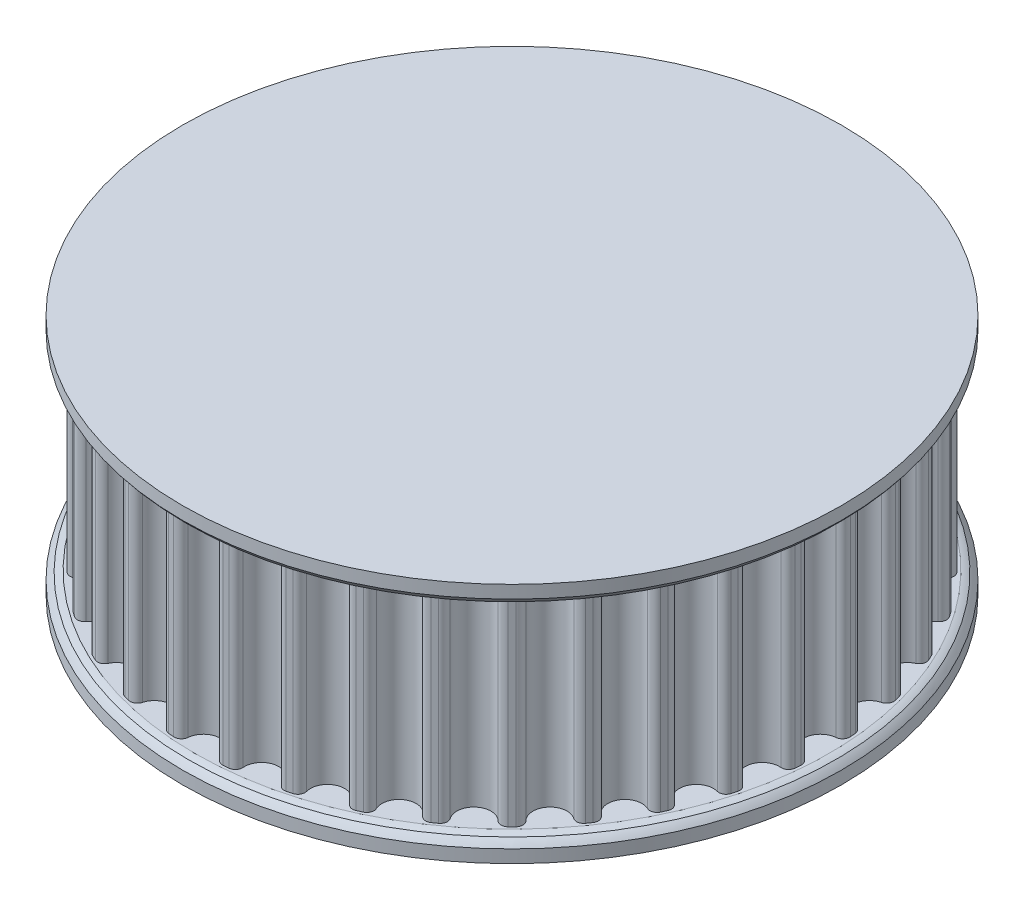
from build123d import *

# Parameters (mm, degrees)
SKETCH1_R               = 28.076389218
TOOTHOD_DEPTH           = 8.89
TOOTHPROFILE_DEPTH      = 44.505122262
TOOTHPATTERN_COUNT      = 36
LARGE_TOOTH_COUNT_DEPTH = 0.4


with BuildPart() as part:
    # Sketch1 → ToothOD (new, symmetric)
    with BuildSketch(Plane(origin=(0, 0, 0), x_dir=(1, 0, 0), z_dir=(0, 1, 0))):
        Circle(SKETCH1_R)
    extrude(amount=TOOTHOD_DEPTH, both=True)

    # Sketch2 → ToothProfile (cut, through all)
    with BuildSketch(Plane(origin=(0, 8.89, 0), x_dir=(1, 0, 0), z_dir=(0, 1, 0))):
        with BuildLine():
            ThreePointArc((-1.519425396, 27.411114635), (0, 26.016389218), (1.519425396, 27.411114635))
            ThreePointArc((1.519425396, 27.411114635), (1.741386688, 27.84115848), (2.201904348, 27.98991334))
            ThreePointArc((2.201904348, 27.98991334), (0, 28.076389218), (-2.201904348, 27.98991334))
            ThreePointArc((-2.201904348, 27.98991334), (-1.741386688, 27.84115848), (-1.519425396, 27.411114635))
        make_face()
    toothprofile = extrude(amount=-TOOTHPROFILE_DEPTH, mode=Mode.SUBTRACT)

    # ToothPattern: ToothProfile ×36 about axis
    toothpattern_axis = Axis((0, 8.89, 0), (0, -1, 0))
    for i in range(1, TOOTHPATTERN_COUNT):
        add(toothprofile.rotate(toothpattern_axis, i * 360 / TOOTHPATTERN_COUNT), mode=Mode.SUBTRACT)

    # Sketch4 → Flange (revolve)
    with BuildSketch(Plane.XY):
        with BuildLine():
            Line((0, -8.89), (28.330389218, -8.89))
            ThreePointArc((28.330389218, -8.89), (28.622194325, -8.974570012), (28.901889218, -9.0932))
            ThreePointArc((28.901889218, -9.0932), (29.172412574, -9.357578767), (29.409889218, -9.652))
            Line((29.409889218, -9.652), (29.409889218, -10.795))
            Line((29.409889218, -10.795), (0, -10.795))
            Line((0, -10.795), (0, -8.89))
        make_face()
        with BuildLine():
            Line((29.409889218, 10.795), (29.409889218, 9.652))
            ThreePointArc((29.409889218, 9.652), (29.172412574, 9.357578767), (28.901889218, 9.0932))
            ThreePointArc((28.901889218, 9.0932), (28.622194325, 8.974570012), (28.330389218, 8.89))
            Line((28.330389218, 8.89), (0, 8.89))
            Line((0, 8.89), (0, 10.795))
            Line((0, 10.795), (29.409889218, 10.795))
        make_face()
    revolve(axis=Axis((0, 12.09802, 0), (0, -1, 0)))

    # Sketch9 → Large Tooth Count (cut)
    # profile 1 of 2: a face of its own
    with BuildSketch(Plane(origin=(0, -10.795, 0), x_dir=(1, 0, 0), z_dir=(0, 1, 0))):
        with BuildLine():
            add(Edge.make_bspline(
                [(-2.884035079, 25.927679637), (-2.831676012, 25.935237516), (-2.730252931, 25.949877644), (-2.58669487, 25.993768546), (-2.458259474, 26.056460669), (-2.362230068, 26.121449448), (-2.296426388, 26.182481156), (-2.253636382, 26.230682319), (-2.219715568, 26.283045088), (-2.192664524, 26.337867987), (-2.172518049, 26.395647847), (-2.16104916, 26.457006077), (-2.157528887, 26.521543707), (-2.160831448, 26.565273661), (-2.162516329, 26.587583543)],
                knots=[0, 0, 0, 0, 1.740208258, 3.370902021, 4.918261647, 6.432614837, 7.167760741, 7.869410875, 8.549014845, 9.215271657, 9.878566188, 10.557109216, 11.263874728, 12, 12, 12, 12], degree=3))
            add(Edge.make_bspline(
                [(-2.162516329, 26.587583543), (-2.168309962, 26.620819923), (-2.179845778, 26.686997533), (-2.227023614, 26.778371141), (-2.295512282, 26.859205997), (-2.382786865, 26.930315039), (-2.488774153, 26.987091558), (-2.611502829, 27.022461704), (-2.748728814, 27.036528925), (-2.843865988, 27.029647292), (-2.893857735, 27.026031199)],
                knots=[0, 0, 0, 0, 0.850222227, 1.69289423, 2.565277518, 3.518771223, 4.526967617, 5.588199176, 6.732670613, 8, 8, 8, 8], degree=3))
            add(Edge.make_bspline(
                [(-2.893857735, 27.026031199), (-2.92519036, 27.022035905), (-2.984912793, 27.014420561), (-3.06865422, 26.996306196), (-3.142935182, 26.975659708), (-3.206800454, 26.948595372), (-3.26197893, 26.917583508), (-3.311151317, 26.88437953), (-3.354161976, 26.847244774), (-3.390652967, 26.804403565), (-3.424514552, 26.756483269), (-3.457551376, 26.701050286), (-3.489243823, 26.636095401), (-3.531981604, 26.541005654), (-3.580933608, 26.420452311), (-3.61983903, 26.324750239), (-3.638593673, 26.278616356)],
                knots=[0, 0, 0, 0, 1.161651273, 2.214198214, 3.149950597, 3.994119379, 4.758968706, 5.475895687, 6.174433602, 6.842065939, 7.541033011, 8.331790609, 9.213421938, 10.19868972, 12.167550603, 14, 14, 14, 14], degree=3))
            add(Edge.make_bspline(
                [(-3.638593673, 26.278616356), (-3.646170923, 26.267210396), (-3.662416976, 26.242755373), (-3.699286097, 26.211670581), (-3.7458031, 26.181540903), (-3.823295482, 26.143666354), (-3.934323504, 26.104723777), (-4.029067247, 26.090429117), (-4.077934298, 26.083056199)],
                knots=[0, 0, 0, 0, 0.496768473, 1.06509974, 1.738921352, 2.514965206, 4.202484234, 6, 6, 6, 6], degree=3))
            add(Edge.make_bspline(
                [(-4.077934298, 26.083056199), (-4.106241545, 26.081416765), (-4.162271571, 26.078171746), (-4.246315592, 26.091797676), (-4.327983067, 26.118868779), (-4.406188329, 26.159098577), (-4.475177937, 26.213899794), (-4.52928993, 26.282443075), (-4.566421022, 26.363353756), (-4.575822274, 26.42230927), (-4.580675704, 26.452745262)],
                knots=[0, 0, 0, 0, 0.977955687, 1.935719217, 2.921872316, 3.943841516, 4.961292039, 5.943408913, 6.938277607, 8, 8, 8, 8], degree=3))
            add(Edge.make_bspline(
                [(-4.580675704, 26.452745262), (-4.582413519, 26.482561203), (-4.585962389, 26.54344967), (-4.569342161, 26.636656979), (-4.541264903, 26.732785573), (-4.495268699, 26.83040787), (-4.435694867, 26.928823925), (-4.361596837, 27.026775064), (-4.273409128, 27.123230795), (-4.171745717, 27.218679007), (-4.055926967, 27.310754187), (-3.924609587, 27.395819511), (-3.778335496, 27.472933754), (-3.618782111, 27.544500161), (-3.446104378, 27.606800017), (-3.261557175, 27.657429942), (-3.066377183, 27.696921381), (-2.932090435, 27.71388289), (-2.863496798, 27.722546824)],
                knots=[0, 0, 0, 0, 0.615610725, 1.25716618, 1.944558692, 2.682656439, 3.480656993, 4.320183036, 5.21778266, 6.180091238, 7.200929026, 8.273026521, 9.410230507, 10.616978748, 11.88637631, 13.201922651, 14.570742808, 16, 16, 16, 16], degree=3))
            add(Edge.make_bspline(
                [(-2.863496798, 27.722546824), (-2.801040711, 27.728416835), (-2.678395584, 27.739943785), (-2.49640722, 27.743130786), (-2.320678615, 27.735535718), (-2.15153077, 27.715743326), (-1.990004054, 27.685726804), (-1.837228499, 27.645074524), (-1.694123755, 27.592969505), (-1.561461133, 27.530738031), (-1.440349165, 27.460043773), (-1.332779968, 27.381116033), (-1.240133777, 27.294123054), (-1.162128365, 27.20002527), (-1.098231171, 27.100427765), (-1.048737485, 26.996434628), (-1.013707029, 26.887969684), (-1.002712281, 26.813426233), (-0.99719211, 26.775999949)],
                knots=[0, 0, 0, 0, 1.300087848, 2.552984794, 3.769882269, 4.944020676, 6.080453409, 7.173156751, 8.21753888, 9.233384416, 10.207027551, 11.120313229, 11.993375782, 12.834812446, 13.647895471, 14.440080806, 15.216806077, 16, 16, 16, 16], degree=3))
            add(Edge.make_bspline(
                [(-0.99719211, 26.775999949), (-0.993812882, 26.727182758), (-0.987177237, 26.631322533), (-1.004634552, 26.489473977), (-1.045608962, 26.354971958), (-1.109148959, 26.228528938), (-1.192177437, 26.109685322), (-1.288558972, 25.995016467), (-1.401207213, 25.886306204), (-1.484747953, 25.820406139), (-1.527615548, 25.786590574)],
                knots=[0, 0, 0, 0, 0.994362274, 1.952586578, 2.889873616, 3.843700919, 4.820142602, 5.834897802, 6.889012454, 8, 8, 8, 8], degree=3))
            add(Edge.make_bspline(
                [(-1.527615548, 25.786590574), (-1.483921418, 25.775154255), (-1.396555963, 25.752287586), (-1.269869753, 25.704220139), (-1.146916588, 25.64685252), (-1.029202007, 25.580442591), (-0.91938119, 25.507042002), (-0.822553539, 25.425818833), (-0.737188336, 25.341090279), (-0.666868788, 25.249668835), (-0.608603087, 25.153985793), (-0.564054797, 25.053770754), (-0.531610115, 24.949157873), (-0.521739913, 24.877155759), (-0.516774923, 24.840936668)],
                knots=[0, 0, 0, 0, 1.102611994, 2.204648487, 3.304091498, 4.414276908, 5.503259953, 6.525433276, 7.497150733, 8.435207282, 9.335505779, 10.227308477, 11.108286225, 12, 12, 12, 12], degree=3))
            add(Edge.make_bspline(
                [(-0.516774923, 24.840936668), (-0.513849553, 24.796897509), (-0.507970285, 24.708389726), (-0.520025694, 24.573539396), (-0.552314148, 24.438624014), (-0.600551992, 24.303302863), (-0.666708579, 24.169788896), (-0.752831196, 24.040500635), (-0.85703851, 23.915169148), (-0.979030067, 23.795516716), (-1.11696605, 23.683104806), (-1.26892908, 23.579025512), (-1.436159631, 23.486862558), (-1.615160774, 23.402428681), (-1.807803446, 23.330956402), (-2.012846829, 23.273645666), (-2.229292721, 23.227229095), (-2.378436582, 23.208381552), (-2.45451711, 23.198767137)],
                knots=[0, 0, 0, 0, 0.755203296, 1.517771262, 2.308060925, 3.125688854, 3.973902143, 4.853469949, 5.780450698, 6.761094328, 7.775587867, 8.82489599, 9.911398865, 11.042734214, 12.212345687, 13.426033089, 14.686980735, 16, 16, 16, 16], degree=3))
            add(Edge.make_bspline(
                [(-2.45451711, 23.198767137), (-2.529467064, 23.19220388), (-2.675913804, 23.179379756), (-2.891552856, 23.180819652), (-3.096988771, 23.197584337), (-3.290571001, 23.234104882), (-3.471477613, 23.282696223), (-3.638085246, 23.342953843), (-3.790760339, 23.410984722), (-3.927790765, 23.489997099), (-4.049817302, 23.57620339), (-4.159730043, 23.665034841), (-4.254493371, 23.758984264), (-4.33468031, 23.854855546), (-4.399311223, 23.949471449), (-4.449248224, 24.039122477), (-4.484450048, 24.122860354), (-4.494054733, 24.178409811), (-4.498522579, 24.204249949)],
                knots=[0, 0, 0, 0, 1.463172344, 2.858932019, 4.190230326, 5.468155111, 6.686213122, 7.831185274, 8.912022685, 9.934231927, 10.903072954, 11.816660061, 12.680756471, 13.494949328, 14.245119792, 14.906085201, 15.491139763, 16, 16, 16, 16], degree=3))
            add(Edge.make_bspline(
                [(-4.498522579, 24.204249949), (-4.50006884, 24.235888809), (-4.503069308, 24.297282978), (-4.481586241, 24.38699047), (-4.437851922, 24.468089505), (-4.373556805, 24.538498443), (-4.295482452, 24.598890857), (-4.205251386, 24.645697399), (-4.105529563, 24.679384387), (-4.034721197, 24.68937406), (-3.998460079, 24.694489793)],
                knots=[0, 0, 0, 0, 0.968847013, 1.880015804, 2.791871975, 3.76951731, 4.785997872, 5.808092692, 6.877519493, 8, 8, 8, 8], degree=3))
            add(Edge.make_bspline(
                [(-3.998460079, 24.694489793), (-3.974965677, 24.696124286), (-3.928273504, 24.699372635), (-3.857918034, 24.696358071), (-3.788663499, 24.681941274), (-3.72190746, 24.66187228), (-3.660623004, 24.638326265), (-3.610751576, 24.610414406), (-3.570604586, 24.582724638), (-3.553553566, 24.558955879), (-3.545724923, 24.548042918)],
                knots=[0, 0, 0, 0, 1.144246022, 2.274045192, 3.408834094, 4.571313731, 5.661908395, 6.587819549, 7.351624938, 8, 8, 8, 8], degree=3))
            add(Edge.make_bspline(
                [(-3.545724923, 24.548042918), (-3.525717534, 24.516338517), (-3.486981127, 24.454955469), (-3.426827037, 24.368177999), (-3.367952935, 24.288591619), (-3.31025799, 24.216158581), (-3.252867741, 24.151625391), (-3.196625893, 24.09431093), (-3.141549456, 24.044015431), (-3.086098207, 24.00117264), (-3.029132295, 23.964469613), (-2.968142217, 23.935197082), (-2.903526836, 23.911812853), (-2.834924299, 23.894962119), (-2.76234196, 23.883546738), (-2.685631209, 23.876913976), (-2.604988049, 23.878339412), (-2.550338462, 23.883050283), (-2.522382735, 23.885460106)],
                knots=[0, 0, 0, 0, 1.377426613, 2.666842544, 3.878731997, 5.014650271, 6.068286915, 7.050530189, 7.964316377, 8.806572593, 9.622789314, 10.449491317, 11.286761617, 12.143592161, 13.04086477, 13.984597961, 14.96903103, 16, 16, 16, 16], degree=3))
            add(Edge.make_bspline(
                [(-2.522382735, 23.885460106), (-2.48591882, 23.89031782), (-2.413424095, 23.89997555), (-2.30770656, 23.928554587), (-2.205442659, 23.966081533), (-2.107348104, 24.013133647), (-2.015616452, 24.069767182), (-1.932744994, 24.135984709), (-1.860983699, 24.211631507), (-1.799880333, 24.294578074), (-1.751840056, 24.384472288), (-1.721723321, 24.480407445), (-1.705817097, 24.580367169), (-1.710812271, 24.647726278), (-1.713353048, 24.681988231)],
                knots=[0, 0, 0, 0, 1.049908396, 2.087346306, 3.120418978, 4.158692913, 5.189839026, 6.193805202, 7.18018844, 8.15984137, 9.129739993, 10.07632233, 11.02152871, 12, 12, 12, 12], degree=3))
            add(Edge.make_bspline(
                [(-1.713353048, 24.681988231), (-1.716728509, 24.707373535), (-1.72330294, 24.756816833), (-1.741262448, 24.828201443), (-1.766570373, 24.894483647), (-1.797350643, 24.956285541), (-1.835686746, 25.01229361), (-1.879720782, 25.063805162), (-1.93076613, 25.110217601), (-1.988211198, 25.151174185), (-2.050863454, 25.187162086), (-2.119201536, 25.216641075), (-2.192557515, 25.239652801), (-2.271137076, 25.25686443), (-2.35485386, 25.266873856), (-2.443416816, 25.272729332), (-2.537151934, 25.270550457), (-2.600994145, 25.264601081), (-2.634003829, 25.261524949)],
                knots=[0, 0, 0, 0, 0.998504333, 1.94480026, 2.863550355, 3.76196865, 4.631558042, 5.504397668, 6.400336112, 7.315557064, 8.25175334, 9.213876129, 10.212785507, 11.246848092, 12.347242561, 13.498948394, 14.706828591, 16, 16, 16, 16], degree=3))
            add(Edge.make_bspline(
                [(-2.634003829, 25.261524949), (-2.647110753, 25.259806662), (-2.677249826, 25.2558555), (-2.727743154, 25.247393336), (-2.789851602, 25.238133973), (-2.858357591, 25.224764209), (-2.926259465, 25.213050885), (-2.984623833, 25.203371247), (-3.029532801, 25.195966439), (-3.054884414, 25.192433136), (-3.065307735, 25.190980418)],
                knots=[0, 0, 0, 0, 0.72581138, 1.668986715, 2.810994872, 4.17347907, 5.500906054, 6.59451956, 7.422136419, 8, 8, 8, 8], degree=3))
            add(Edge.make_bspline(
                [(-3.065307735, 25.190980418), (-3.100997069, 25.188388266), (-3.168834042, 25.183461199), (-3.266382395, 25.188916075), (-3.353595792, 25.208655299), (-3.429989517, 25.240233077), (-3.49472014, 25.284439885), (-3.543698785, 25.341767909), (-3.577809248, 25.410891292), (-3.586061834, 25.461761895), (-3.59037336, 25.488339012)],
                knots=[0, 0, 0, 0, 1.264875514, 2.40422883, 3.441065183, 4.412848931, 5.312378664, 6.185905639, 7.052234581, 8, 8, 8, 8], degree=3))
            add(Edge.make_bspline(
                [(-3.59037336, 25.488339012), (-3.591757012, 25.515300574), (-3.59445853, 25.567941831), (-3.569738036, 25.643733003), (-3.527148692, 25.712640551), (-3.462581343, 25.772093544), (-3.380695764, 25.823860771), (-3.280832698, 25.864426523), (-3.164556894, 25.894507621), (-3.080951892, 25.905691162), (-3.036732735, 25.911606199)],
                knots=[0, 0, 0, 0, 0.827555898, 1.615766271, 2.416902039, 3.307819954, 4.300016632, 5.396284613, 6.62288027, 8, 8, 8, 8], degree=3))
            Line((-3.036732735, 25.911606199), (-2.884035079, 25.927679637))
        make_face()
    # profile 2 of 2: a face of its own
    with BuildSketch(Plane(origin=(0, -10.795, 0), x_dir=(1, 0, 0), z_dir=(0, 1, 0))):
        with BuildLine():
            add(Edge.make_bspline(
                [(2.203501203, 25.74363767), (2.215023059, 25.761764432), (2.238226309, 25.798268946), (2.280235163, 25.848371015), (2.329304488, 25.892938508), (2.382818995, 25.934269908), (2.44211806, 25.970955828), (2.507151625, 26.003043975), (2.577596094, 26.032066064), (2.680955827, 26.062097721), (2.817085193, 26.091442628), (2.987895334, 26.110051601), (3.165887386, 26.11197657), (3.286139857, 26.10044722), (3.347394171, 26.094574389)],
                knots=[0, 0, 0, 0, 0.613444048, 1.235382116, 1.861437296, 2.504597843, 3.165571077, 3.850366405, 4.575455034, 5.339755039, 6.923165713, 8.549326557, 10.242292783, 12, 12, 12, 12], degree=3))
            add(Edge.make_bspline(
                [(3.347394171, 26.094574389), (3.408910985, 26.086136271), (3.529904335, 26.069539895), (3.705512376, 26.026317344), (3.873194952, 25.973025106), (4.030608874, 25.903166275), (4.178411863, 25.823570393), (4.315568354, 25.732717201), (4.440629505, 25.631048558), (4.553095312, 25.518988378), (4.653228281, 25.400314302), (4.737677454, 25.273962675), (4.808287806, 25.142489352), (4.861276433, 25.004812625), (4.899793626, 24.864478788), (4.923639017, 24.722706097), (4.930137615, 24.579932239), (4.922131349, 24.485404829), (4.918126203, 24.438117358)],
                knots=[0, 0, 0, 0, 1.172616085, 2.306340954, 3.412736328, 4.493308033, 5.555437106, 6.581953065, 7.597483961, 8.595811742, 9.578149656, 10.526666918, 11.462710326, 12.392360464, 13.307985237, 14.208664154, 15.103881691, 16, 16, 16, 16], degree=3))
            add(Edge.make_bspline(
                [(4.918126203, 24.438117358), (4.913283884, 24.403799463), (4.903698913, 24.335870016), (4.880346128, 24.236002941), (4.848402725, 24.139729041), (4.811833373, 24.045133486), (4.764220434, 23.955306555), (4.711893931, 23.866929748), (4.650603872, 23.782339153), (4.583190696, 23.700050959), (4.508126206, 23.622866782), (4.427573773, 23.549997653), (4.340735858, 23.48321788), (4.248378213, 23.421293467), (4.150117581, 23.364746112), (4.045097164, 23.315358236), (3.935103639, 23.269317785), (3.819357599, 23.229482624), (3.699264636, 23.195517414), (3.575418743, 23.16892001), (3.44908786, 23.14829036), (3.319692321, 23.134812353), (3.187320688, 23.128868817), (3.052060761, 23.129000207), (2.913728871, 23.134793086), (2.821097626, 23.144592478), (2.774108234, 23.149563451)],
                knots=[0, 0, 0, 0, 0.895354488, 1.772280501, 2.645555456, 3.51543614, 4.389252956, 5.269142703, 6.167795252, 7.085697404, 8.015925239, 8.947297267, 9.890442701, 10.844069236, 11.819139291, 12.816882843, 13.841108761, 14.899288246, 15.97806737, 17.064361734, 18.170866076, 19.284512668, 20.424206853, 21.593396555, 22.779193433, 24, 24, 24, 24], degree=3))
            add(Edge.make_bspline(
                [(2.774108234, 23.149563451), (2.722542, 23.156533406), (2.621103112, 23.170244403), (2.472453755, 23.198589586), (2.330282067, 23.235302408), (2.194485502, 23.279275872), (2.064058675, 23.328994985), (1.940540998, 23.38718065), (1.822495493, 23.451371545), (1.71216861, 23.523926447), (1.607919285, 23.602507082), (1.51159641, 23.688320746), (1.422452188, 23.780495666), (1.342522787, 23.880111831), (1.268508351, 23.985029682), (1.202555889, 24.09671487), (1.144182503, 24.215154295), (1.094342888, 24.340348773), (1.052574841, 24.471705632), (1.018378164, 24.608527587), (0.99365411, 24.751229596), (0.97682342, 24.899714498), (0.967740835, 25.054139119), (0.968289696, 25.214200793), (0.976045921, 25.379909898), (0.987623191, 25.49186448), (0.993528546, 25.548970483)],
                knots=[0, 0, 0, 0, 1.101945886, 2.167700797, 3.202848405, 4.209638408, 5.189542752, 6.156895346, 7.099254405, 8.032970507, 8.950867952, 9.861811528, 10.762444273, 11.663319684, 12.564018617, 13.479770351, 14.407337055, 15.357905209, 16.330829118, 17.324667215, 18.342449987, 19.39577065, 20.488208315, 21.616650366, 22.784296571, 24, 24, 24, 24], degree=3))
            add(Edge.make_bspline(
                [(0.993528546, 25.548970483), (1.005836875, 25.640287129), (1.029888937, 25.818731639), (1.08839206, 26.076412442), (1.163187311, 26.317453911), (1.253990965, 26.541108792), (1.359947349, 26.746207465), (1.480767272, 26.931440077), (1.615839963, 27.095911576), (1.765421979, 27.239136713), (1.92794469, 27.362125926), (2.102836497, 27.465396304), (2.290510971, 27.548213502), (2.4904232, 27.610283502), (2.7015796, 27.65356224), (2.923913686, 27.673848573), (3.15645661, 27.676544073), (3.314133238, 27.661425106), (3.394721515, 27.653697826)],
                knots=[0, 0, 0, 0, 1.218454138, 2.381016589, 3.490681872, 4.553872008, 5.570071317, 6.539888876, 7.474112584, 8.379228779, 9.273080193, 10.164499825, 11.06006687, 11.980403877, 12.928711533, 13.9058874, 14.929702326, 16, 16, 16, 16], degree=3))
            add(Edge.make_bspline(
                [(3.394721515, 27.653697826), (3.475678098, 27.642470068), (3.633345543, 27.620603385), (3.859230435, 27.562432678), (4.069110164, 27.487991796), (4.259602511, 27.394424968), (4.429437608, 27.289460678), (4.577509375, 27.178595849), (4.699692603, 27.059206778), (4.795175882, 26.934140467), (4.86650389, 26.809957838), (4.915651451, 26.690786797), (4.941471869, 26.576668725), (4.938364917, 26.503053151), (4.936878546, 26.467835326)],
                knots=[0, 0, 0, 0, 1.390540602, 2.708155126, 3.963331081, 5.175889778, 6.313652854, 7.358653984, 8.319042404, 9.212016446, 10.029166285, 10.750016722, 11.402005716, 12, 12, 12, 12], degree=3))
            add(Edge.make_bspline(
                [(4.936878546, 26.467835326), (4.932303094, 26.446322496), (4.922878335, 26.402009235), (4.886588583, 26.340170813), (4.833652068, 26.282375249), (4.766401106, 26.228055496), (4.684485563, 26.182741236), (4.589709233, 26.155803836), (4.485508404, 26.143617333), (4.413597269, 26.149532487), (4.376094171, 26.152617358)],
                knots=[0, 0, 0, 0, 0.743286091, 1.531059836, 2.39777145, 3.397524334, 4.456444525, 5.553923108, 6.724321896, 8, 8, 8, 8], degree=3))
            add(Edge.make_bspline(
                [(4.376094171, 26.152617358), (4.348257771, 26.156954978), (4.293230914, 26.165529563), (4.213777719, 26.190977725), (4.138837408, 26.227319354), (4.068868076, 26.273170891), (4.006272651, 26.328256437), (3.953913414, 26.391523507), (3.911733627, 26.461899257), (3.893354508, 26.513301602), (3.88406839, 26.539272826)],
                knots=[0, 0, 0, 0, 1.020618409, 2.017553351, 3.012206103, 4.033224094, 5.042705437, 6.024088088, 7.001663227, 8, 8, 8, 8], degree=3))
            add(Edge.make_bspline(
                [(3.88406839, 26.539272826), (3.873324261, 26.566768676), (3.851801531, 26.621848595), (3.803453662, 26.697792733), (3.741284685, 26.766009244), (3.668466071, 26.828401454), (3.584723299, 26.881889352), (3.491135409, 26.924025798), (3.389259211, 26.955975114), (3.317244522, 26.966227425), (3.280421515, 26.971469701)],
                knots=[0, 0, 0, 0, 0.903240237, 1.809378505, 2.739763284, 3.723375079, 4.740762313, 5.773657041, 6.861612198, 8, 8, 8, 8], degree=3))
            add(Edge.make_bspline(
                [(3.280421515, 26.971469701), (3.253939005, 26.973653223), (3.199769885, 26.978119545), (3.116809272, 26.971608421), (3.031034519, 26.957769479), (2.944289309, 26.93205381), (2.856633168, 26.898900971), (2.77158228, 26.853814591), (2.68942069, 26.797839573), (2.63855031, 26.75381981), (2.61248089, 26.731261108)],
                knots=[0, 0, 0, 0, 0.870812824, 1.781219528, 2.722345853, 3.718018339, 4.744833727, 5.793581382, 6.869281978, 8, 8, 8, 8], degree=3))
            add(Edge.make_bspline(
                [(2.61248089, 26.731261108), (2.589391168, 26.708398273), (2.541069459, 26.660551389), (2.480925295, 26.57187818), (2.422544372, 26.470945028), (2.369062024, 26.354582885), (2.320113191, 26.223278016), (2.277382508, 26.076397025), (2.236588725, 25.915414), (2.214820947, 25.802404964), (2.203501203, 25.74363767)],
                knots=[0, 0, 0, 0, 0.717079135, 1.5006889, 2.358837939, 3.295387785, 4.328582991, 5.455330196, 6.676713245, 8, 8, 8, 8], degree=3))
        make_face()
        with BuildLine():
            add(Edge.make_bspline(
                [(2.872334796, 23.832684545), (2.900886719, 23.830085583), (2.957026674, 23.824975396), (3.040391895, 23.826257068), (3.120980224, 23.833588017), (3.198102034, 23.85059927), (3.273002242, 23.871845996), (3.343433196, 23.904340305), (3.412143437, 23.941561906), (3.476696777, 23.986948321), (3.536587254, 24.038662562), (3.590397128, 24.096167161), (3.638169398, 24.158736518), (3.67801245, 24.227171204), (3.712826354, 24.300031381), (3.738813154, 24.378824871), (3.760027422, 24.462636469), (3.768231434, 24.520761987), (3.772447296, 24.55063142)],
                knots=[0, 0, 0, 0, 1.063199481, 2.090506127, 3.089574568, 4.060086087, 5.01756152, 5.97197384, 6.931104374, 7.914727289, 8.893563084, 9.862564862, 10.832384707, 11.807974355, 12.796237756, 13.823188049, 14.88138394, 16, 16, 16, 16], degree=3))
            add(Edge.make_bspline(
                [(3.772447296, 24.55063142), (3.775716515, 24.590475797), (3.782083361, 24.668073225), (3.776622421, 24.782163646), (3.753588864, 24.888714689), (3.717849966, 24.987590213), (3.669616277, 25.078268975), (3.608933108, 25.159690372), (3.536754778, 25.231507698), (3.454303014, 25.293979024), (3.363629978, 25.346301035), (3.265998601, 25.387994136), (3.162067343, 25.417512207), (3.090074131, 25.428308748), (3.053607453, 25.433777514)],
                knots=[0, 0, 0, 0, 1.123188771, 2.187424354, 3.19665849, 4.176003339, 5.134283769, 6.07307922, 7.019709396, 7.986970209, 8.972905249, 9.955105337, 10.964200728, 12, 12, 12, 12], degree=3))
            add(Edge.make_bspline(
                [(3.053607453, 25.433777514), (3.021481818, 25.436648256), (2.957559994, 25.442360302), (2.861144489, 25.436895873), (2.764892507, 25.423121067), (2.670216466, 25.397173284), (2.578635289, 25.360939644), (2.493036226, 25.312175004), (2.413968052, 25.251625787), (2.341585516, 25.180724548), (2.279199139, 25.098159549), (2.230642215, 25.00364339), (2.195370094, 24.898191406), (2.183647808, 24.823230622), (2.177605109, 24.784589233)],
                knots=[0, 0, 0, 0, 0.951599433, 1.893440289, 2.844714694, 3.81947098, 4.7860635, 5.746879999, 6.719373238, 7.72038541, 8.731540898, 9.761896176, 10.846284194, 12, 12, 12, 12], degree=3))
            add(Edge.make_bspline(
                [(2.177605109, 24.784589233), (2.174736783, 24.753066433), (2.169143181, 24.691592936), (2.169089268, 24.600452135), (2.176929417, 24.513130247), (2.192893435, 24.429591397), (2.217393581, 24.35005038), (2.249456039, 24.274375283), (2.289061918, 24.202137628), (2.336277013, 24.134652741), (2.389551715, 24.072780664), (2.446850289, 24.016692612), (2.508587051, 23.968705582), (2.573697058, 23.927088001), (2.642421195, 23.891639166), (2.716026163, 23.865774142), (2.792535768, 23.844143982), (2.845422004, 23.836549322), (2.872334796, 23.832684545)],
                knots=[0, 0, 0, 0, 1.152285992, 2.247105266, 3.313875461, 4.340684999, 5.338476187, 6.339089653, 7.32878132, 8.333145488, 9.332525188, 10.298423288, 11.248189752, 12.174342225, 13.109961579, 14.056443896, 15.010961536, 16, 16, 16, 16], degree=3))
        make_face(mode=Mode.SUBTRACT)
    large_tooth_count = extrude(amount=LARGE_TOOTH_COUNT_DEPTH, mode=Mode.SUBTRACT)

    # Mirror1: Large Tooth Count across plane
    add(large_tooth_count.mirror(Plane.XY), mode=Mode.SUBTRACT)


solid = part.part
